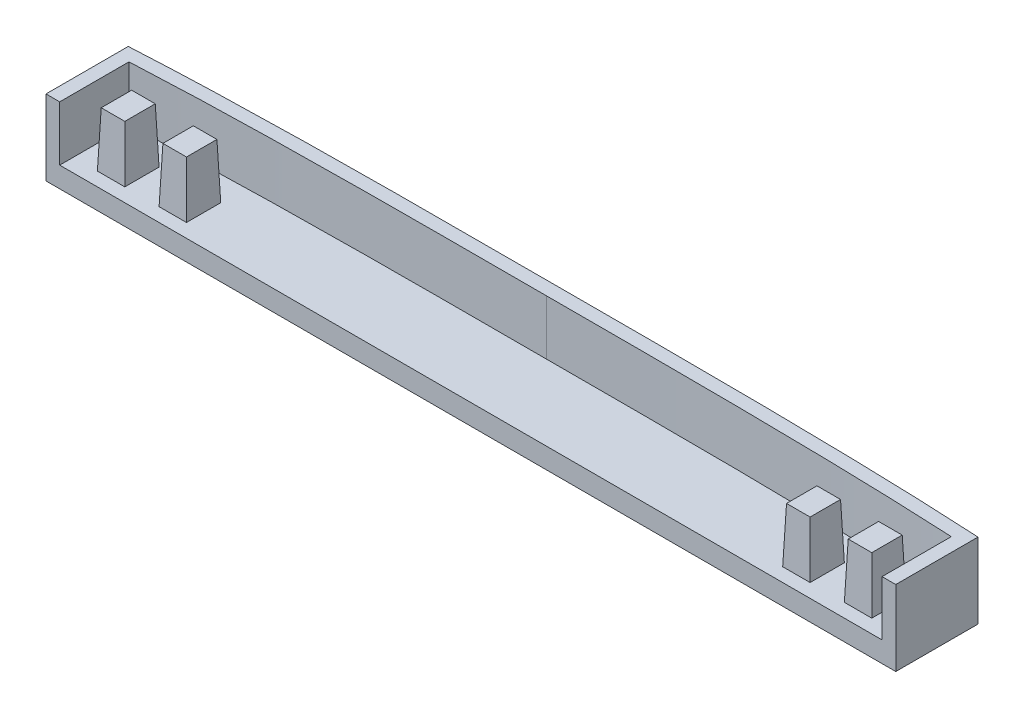
from build123d import *

# Parameters (mm, degrees)
BOSS_EXTRUDE1_DEPTH           = 5.5
SHELL1_START                  = 1.5
SHELL1_DEPTH                  = 4
SKETCH2_W                     = 60
SKETCH2_H                     = 1.5
CUT_EXTRUDE1_DEPTH            = 4
SKETCH3_W                     = 2
SKETCH3_H                     = 2.5
BOSS_EXTRUDE2_DEPTH           = 4
BOSS_EXTRUDE2_DRAFT           = 2
BOSS_EXTRUDE2_PROFILE_2_DEPTH = 4
BOSS_EXTRUDE2_PROFILE_2_DRAFT = 2
BOSS_EXTRUDE2_PROFILE_3_DEPTH = 4
BOSS_EXTRUDE2_PROFILE_3_DRAFT = 2
BOSS_EXTRUDE2_PROFILE_4_DEPTH = 4
BOSS_EXTRUDE2_PROFILE_4_DRAFT = 2


# Read off the part's stored shape, not the designer's step: Shell1
with BuildPart() as part:
    # Sketch1 → Boss-Extrude1 (new body)
    with BuildSketch(Plane(origin=(0, 0, 0), x_dir=(1, 0, 0), z_dir=(0, 1, 0))):
        with BuildLine():
            Line((31, 0), (-31, 0))
            Line((-31, 0), (-31, 6))
            add(Edge.make_bspline(
                [(-31, 6), (-21.251552307, 6.554467458), (-9.203050956, 6.5), (0, 6.5)],
                knots=[0, 0, 0, 0, 1, 1, 1, 1], degree=3))
            add(Edge.make_bspline(
                [(31, 6), (21.251552307, 6.554467458), (9.203050956, 6.5), (0, 6.5)],
                knots=[0, 0, 0, 0, 1, 1, 1, 1], degree=3))
            Line((31, 6), (31, 0))
        make_face()
    extrude(amount=BOSS_EXTRUDE1_DEPTH)

    # Shell1 outline → Shell1 (cut)
    with BuildSketch(Plane(origin=(0, 0, 0), x_dir=(1, 0, 0), z_dir=(0, 1, 0)).offset(SHELL1_START)):
        with BuildLine():
            Line((30, 1.5), (30.000000232, 5.053006819))
            add(Edge.make_bspline(
                [(30.000000232, 5.053006819), (25.916795407, 5.266006792), (21.541143574, 5.401179028), (17.009765715, 5.47498256), (12.456456582, 5.504681732), (8.015034126, 5.507287911), (3.818902414, 5.5), (-3.818902414, 5.5), (-8.015034126, 5.507287911), (-12.456456582, 5.504681732), (-17.009765715, 5.47498256), (-21.541143574, 5.401179028), (-25.916795407, 5.266006792), (-30.000000232, 5.053006819)],
                knots=[0.032173822, 0.032173822, 0.032173822, 0.032173822, 0.032173822, 0.032173822, 0.032173822, 0.032173822, 1, 1, 1, 1, 1, 1, 1.967826178, 1.967826178, 1.967826178, 1.967826178, 1.967826178, 1.967826178, 1.967826178, 1.967826178], degree=7))
            Line((-30.000000232, 5.053006819), (-30, 1.5))
            Line((-30, 1.5), (30, 1.5))
        make_face()
    extrude(amount=SHELL1_DEPTH, mode=Mode.SUBTRACT)

    # Sketch2 → Cut-Extrude1 (cut)
    with BuildSketch(Plane(origin=(0, 5.5, 0), x_dir=(1, 0, 0), z_dir=(0, 1, 0))):
        with Locations((0, 0.75)):
            Rectangle(SKETCH2_W, SKETCH2_H)
    extrude(amount=-CUT_EXTRUDE1_DEPTH, mode=Mode.SUBTRACT)


with BuildPart() as boss_extrude2_tool:
    # Sketch3 → Boss-Extrude2 (with draft: the straight prism first)
    with BuildSketch(Plane(origin=(0, 1.5, 0), x_dir=(1, 0, 0), z_dir=(0, 1, 0))):
        with Locations((-27.25, 2.25)):
            Rectangle(SKETCH3_W, SKETCH3_H)
    extrude(amount=BOSS_EXTRUDE2_DEPTH)
    # Boss-Extrude2: the draft: its side faces are tilted about the plane it starts from
    boss_extrude2_sides = [boss_extrude2_tool.faces().sort_by_distance(p)[0] for p in [
        (-28.25, 3.5, -2.25),
        (-27.25, 3.5, -1),
        (-26.25, 3.5, -2.25),
        (-27.25, 3.5, -3.5),
    ]]
    draft(boss_extrude2_sides, Plane(origin=(0, 1.5, 0), x_dir=(1, 0, 0), z_dir=(0, 1, 0)), BOSS_EXTRUDE2_DRAFT)


with BuildPart() as part_1:
    add(part.part)

    # Boss-Extrude2: add boss_extrude2_tool
    add(boss_extrude2_tool.part)


with BuildPart() as boss_extrude2_profile_2_tool:
    # Sketch3 → Boss-Extrude2 profile 2 (with draft: the straight prism first)
    with BuildSketch(Plane(origin=(0, 1.5, 0), x_dir=(1, 0, 0), z_dir=(0, 1, 0))):
        with Locations((22.75, 2.25)):
            Rectangle(SKETCH3_W, SKETCH3_H)
    extrude(amount=BOSS_EXTRUDE2_PROFILE_2_DEPTH)
    # Boss-Extrude2 profile 2: the draft: its side faces are tilted about the plane it starts from
    boss_extrude2_profile_2_sides = [boss_extrude2_profile_2_tool.faces().sort_by_distance(p)[0] for p in [
        (21.75, 3.5, -2.25),
        (22.75, 3.5, -1),
        (23.75, 3.5, -2.25),
        (22.75, 3.5, -3.5),
    ]]
    draft(boss_extrude2_profile_2_sides, Plane(origin=(0, 1.5, 0), x_dir=(1, 0, 0), z_dir=(0, 1, 0)), BOSS_EXTRUDE2_PROFILE_2_DRAFT)


with BuildPart() as part_2:
    add(part_1.part)

    # Boss-Extrude2 profile 2: add boss_extrude2_profile_2_tool
    add(boss_extrude2_profile_2_tool.part)


with BuildPart() as boss_extrude2_profile_3_tool:
    # Sketch3 → Boss-Extrude2 profile 3 (with draft: the straight prism first)
    with BuildSketch(Plane(origin=(0, 1.5, 0), x_dir=(1, 0, 0), z_dir=(0, 1, 0))):
        with Locations((-22.75, 2.25)):
            Rectangle(SKETCH3_W, SKETCH3_H)
    extrude(amount=BOSS_EXTRUDE2_PROFILE_3_DEPTH)
    # Boss-Extrude2 profile 3: the draft: its side faces are tilted about the plane it starts from
    boss_extrude2_profile_3_sides = [boss_extrude2_profile_3_tool.faces().sort_by_distance(p)[0] for p in [
        (-23.75, 3.5, -2.25),
        (-22.75, 3.5, -1),
        (-21.75, 3.5, -2.25),
        (-22.75, 3.5, -3.5),
    ]]
    draft(boss_extrude2_profile_3_sides, Plane(origin=(0, 1.5, 0), x_dir=(1, 0, 0), z_dir=(0, 1, 0)), BOSS_EXTRUDE2_PROFILE_3_DRAFT)


with BuildPart() as part_3:
    add(part_2.part)

    # Boss-Extrude2 profile 3: add boss_extrude2_profile_3_tool
    add(boss_extrude2_profile_3_tool.part)


with BuildPart() as boss_extrude2_profile_4_tool:
    # Sketch3 → Boss-Extrude2 profile 4 (with draft: the straight prism first)
    with BuildSketch(Plane(origin=(0, 1.5, 0), x_dir=(1, 0, 0), z_dir=(0, 1, 0))):
        with Locations((27.25, 2.25)):
            Rectangle(SKETCH3_W, SKETCH3_H)
    extrude(amount=BOSS_EXTRUDE2_PROFILE_4_DEPTH)
    # Boss-Extrude2 profile 4: the draft: its side faces are tilted about the plane it starts from
    boss_extrude2_profile_4_sides = [boss_extrude2_profile_4_tool.faces().sort_by_distance(p)[0] for p in [
        (26.25, 3.5, -2.25),
        (27.25, 3.5, -1),
        (28.25, 3.5, -2.25),
        (27.25, 3.5, -3.5),
    ]]
    draft(boss_extrude2_profile_4_sides, Plane(origin=(0, 1.5, 0), x_dir=(1, 0, 0), z_dir=(0, 1, 0)), BOSS_EXTRUDE2_PROFILE_4_DRAFT)


with BuildPart() as part_4:
    add(part_3.part)

    # Boss-Extrude2 profile 4: add boss_extrude2_profile_4_tool
    add(boss_extrude2_profile_4_tool.part)


solid = part_4.part
